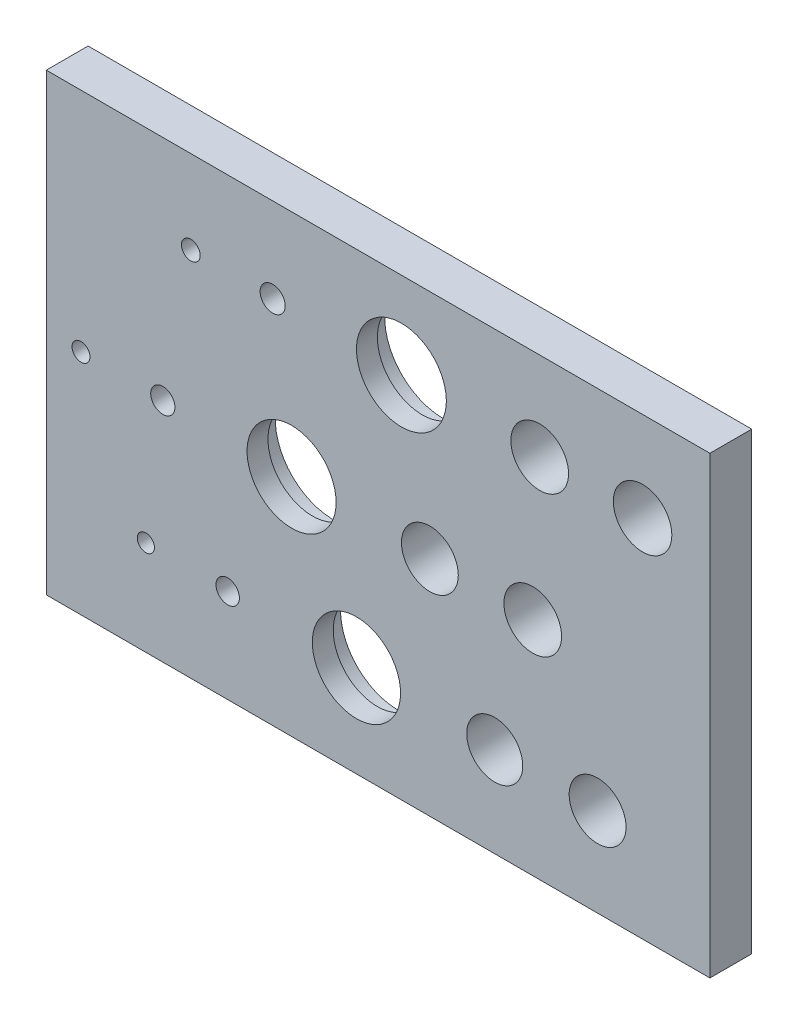
from build123d import *

# Parameters (mm, degrees)
SKETCH1_13_W        = 158.723223419
SKETCH1_13_H        = 108.694445606
SKETCH1_13_R        = 2.05
SKETCH1_13_R_2      = 6.5
SKETCH1_13_R_3      = 13.8
SKETCH1_13_R_4      = 6.6
SKETCH1_13_R_5      = 13.9
SKETCH1_13_R_6      = 6.7
SKETCH1_13_R_7      = 6.8
SKETCH1_13_R_8      = 6.9
SKETCH1_13_R_9      = 2.15
SKETCH1_13_R_10     = 2.25
SKETCH1_13_R_11     = 14
SKETCH1_13_R_12     = 7
BOSS_EXTRUDE8_DEPTH = 5
BOSS_EXTRUDE9_START = 5
SKETCH1_14_W        = 158.723223419
SKETCH1_14_H        = 108.694445606
SKETCH1_14_R        = 2.05
SKETCH1_14_R_2      = 6.7
SKETCH1_14_R_3      = 6.8
SKETCH1_14_R_4      = 6.9
SKETCH1_14_R_5      = 2.15
SKETCH1_14_R_6      = 2.25
SKETCH1_14_R_7      = 7
SKETCH1_14_R_8      = 2.8
SKETCH1_14_R_9      = 10.55
SKETCH1_14_R_10     = 2.9
SKETCH1_14_R_11     = 10.65
SKETCH1_14_R_12     = 3
SKETCH1_14_R_13     = 10.75
BOSS_EXTRUDE9_DEPTH = 5


with BuildPart() as part:
    # Sketch1<13> → Boss-Extrude8 (new body)
    with BuildSketch(Plane.XY):
        with Locations((1.640362817, 2.419374609)):
            Rectangle(SKETCH1_13_W, SKETCH1_13_H)
        with Locations((-53.907492627, -29.231437753)):
            Circle(SKETCH1_13_R, mode=Mode.SUBTRACT)
        with Locations((-34.335726151, -29.502193416)):
            Circle(SKETCH1_13_R_2, mode=Mode.SUBTRACT)
        with Locations((-3.539889856, -29.928222772)):
            Circle(SKETCH1_13_R_3, mode=Mode.SUBTRACT)
        with Locations((-49.848880487, 2.295465215)):
            Circle(SKETCH1_13_R_4, mode=Mode.SUBTRACT)
        with Locations((-19.053044192, 1.869435859)):
            Circle(SKETCH1_13_R_5, mode=Mode.SUBTRACT)
        with Locations((29.534698579, -30.385776366)):
            Circle(SKETCH1_13_R_6, mode=Mode.SUBTRACT)
        with Locations((54.143740522, -30.726217658)):
            Circle(SKETCH1_13_R_7, mode=Mode.SUBTRACT)
        with Locations((14.021544243, 1.411882264)):
            Circle(SKETCH1_13_R_7, mode=Mode.SUBTRACT)
        with Locations((38.630586187, 1.071440972)):
            Circle(SKETCH1_13_R_8, mode=Mode.SUBTRACT)
        with Locations((-69.420646962, 2.566220877)):
            Circle(SKETCH1_13_R_9, mode=Mode.SUBTRACT)
        with Locations((-43.152120198, 36.767438515)):
            Circle(SKETCH1_13_R_10, mode=Mode.SUBTRACT)
        with Locations((-23.580353722, 36.496682852)):
            Circle(SKETCH1_13_R_6, mode=Mode.SUBTRACT)
        with Locations((7.215482572, 36.070653496)):
            Circle(SKETCH1_13_R_11, mode=Mode.SUBTRACT)
        with Locations((40.290071007, 35.613099901)):
            Circle(SKETCH1_13_R_8, mode=Mode.SUBTRACT)
        with Locations((64.899112951, 35.272658609)):
            Circle(SKETCH1_13_R_12, mode=Mode.SUBTRACT)
    extrude(amount=-BOSS_EXTRUDE8_DEPTH)

    # Sketch1<14> → Boss-Extrude9 (add)
    with BuildSketch(Plane.XY.offset(BOSS_EXTRUDE9_START)):
        with Locations((1.640362817, 2.419374609)):
            Rectangle(SKETCH1_14_W, SKETCH1_14_H)
        with Locations((-53.907492627, -29.231437753)):
            Circle(SKETCH1_14_R, mode=Mode.SUBTRACT)
        with Locations((29.534698579, -30.385776366)):
            Circle(SKETCH1_14_R_2, mode=Mode.SUBTRACT)
        with Locations((54.143740522, -30.726217658)):
            Circle(SKETCH1_14_R_3, mode=Mode.SUBTRACT)
        with Locations((14.021544243, 1.411882264)):
            Circle(SKETCH1_14_R_3, mode=Mode.SUBTRACT)
        with Locations((38.630586187, 1.071440972)):
            Circle(SKETCH1_14_R_4, mode=Mode.SUBTRACT)
        with Locations((-69.420646962, 2.566220877)):
            Circle(SKETCH1_14_R_5, mode=Mode.SUBTRACT)
        with Locations((-43.152120198, 36.767438515)):
            Circle(SKETCH1_14_R_6, mode=Mode.SUBTRACT)
        with Locations((40.290071007, 35.613099901)):
            Circle(SKETCH1_14_R_4, mode=Mode.SUBTRACT)
        with Locations((64.899112951, 35.272658609)):
            Circle(SKETCH1_14_R_7, mode=Mode.SUBTRACT)
        with Locations((-34.335726151, -29.502193416)):
            Circle(SKETCH1_14_R_8, mode=Mode.SUBTRACT)
        with Locations((-3.539889856, -29.928222772)):
            Circle(SKETCH1_14_R_9, mode=Mode.SUBTRACT)
        with Locations((-49.848880487, 2.295465215)):
            Circle(SKETCH1_14_R_10, mode=Mode.SUBTRACT)
        with Locations((-19.053044192, 1.869435859)):
            Circle(SKETCH1_14_R_11, mode=Mode.SUBTRACT)
        with Locations((-23.580353722, 36.496682852)):
            Circle(SKETCH1_14_R_12, mode=Mode.SUBTRACT)
        with Locations((7.215482572, 36.070653496)):
            Circle(SKETCH1_14_R_13, mode=Mode.SUBTRACT)
    extrude(amount=-BOSS_EXTRUDE9_DEPTH)


solid = part.part
